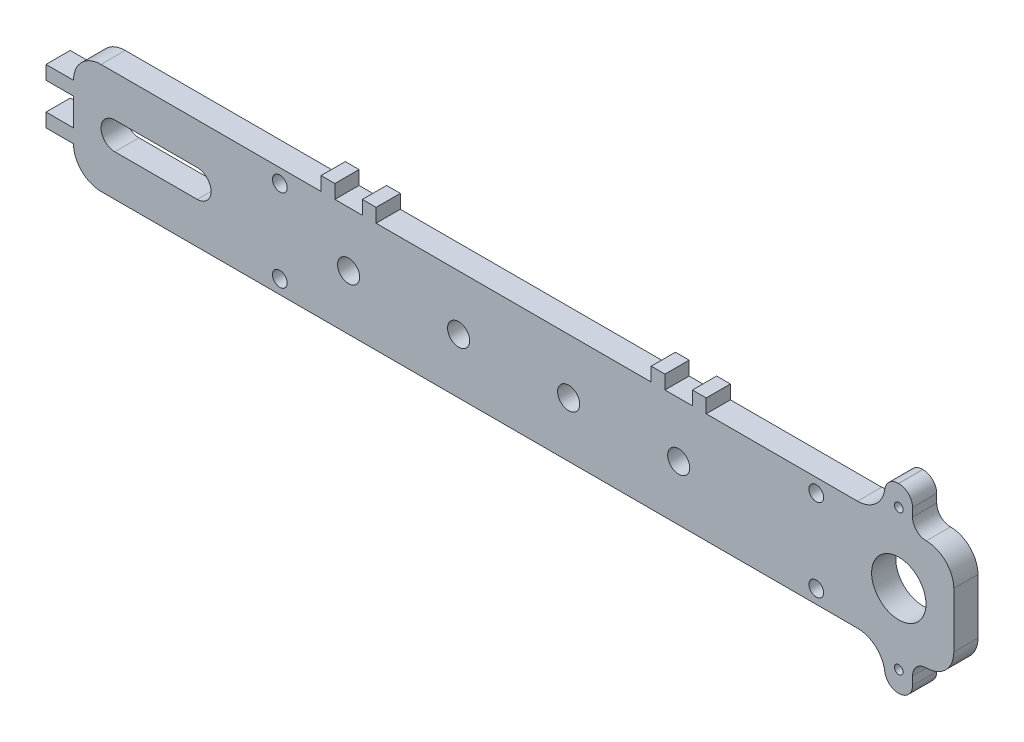
from build123d import *

# Parameters (mm, degrees)
SKETCH2_R           = 1.7
SKETCH2_R_2         = 2.5527
SKETCH2_R_3         = 1
SKETCH2_R_4         = 6.275
BOSS_EXTRUDE1_DEPTH = 5.588
FILLET1_R           = 6.35
FILLET2_R           = 3.175


with BuildPart() as part:
    # Sketch2 → Boss-Extrude1 (new body)
    with BuildSketch(Plane.XY):
        Polygon((-44.45, 12.7), (-101.6, 12.7), (-101.6, 6.35), (-107.95, 6.35), (-107.95, 3.175), (-101.6, 3.175), (-101.6, -3.175), (-107.95, -3.175), (-107.95, -6.35), (-101.6, -6.35), (-101.6, -12.7), (85.725, -12.7), (85.725, -20.9775), (92.075, -20.9775), (92.075, -12.7), (101.6, -12.7), (101.6, 12.7), (92.075, 12.7), (92.075, 20.9775), (85.725, 20.9775), (85.725, 12.7), (44.45, 12.7), (44.45, 15.875), (41.275, 15.875), (41.275, 12.7), (34.925, 12.7), (34.925, 15.875), (31.75, 15.875), (31.75, 12.7), (-31.75, 12.7), (-31.75, 15.875), (-34.925, 15.875), (-34.925, 12.7), (-41.275, 12.7), (-41.275, 15.875), (-44.45, 15.875), align=None)
        with BuildLine():
            ThreePointArc((-92.075, -3.175), (-95.25, 0), (-92.075, 3.175))
            Line((-92.075, 3.175), (-73.025, 3.175))
            ThreePointArc((-73.025, 3.175), (-69.85, 0), (-73.025, -3.175))
            Line((-73.025, -3.175), (-92.075, -3.175))
        make_face(mode=Mode.SUBTRACT)
        with Locations((-53.975, -9.525)):
            Circle(SKETCH2_R, mode=Mode.SUBTRACT)
        with Locations((-38.1, 0)):
            Circle(SKETCH2_R_2, mode=Mode.SUBTRACT)
        with Locations((-12.7, 0)):
            Circle(SKETCH2_R_2, mode=Mode.SUBTRACT)
        with Locations((88.9, -16.215)):
            Circle(SKETCH2_R_3, mode=Mode.SUBTRACT)
        with Locations((12.7, 0)):
            Circle(SKETCH2_R_2, mode=Mode.SUBTRACT)
        with Locations((38.1, 0)):
            Circle(SKETCH2_R_2, mode=Mode.SUBTRACT)
        with Locations((69.85, -9.525)):
            Circle(SKETCH2_R, mode=Mode.SUBTRACT)
        with Locations((88.9, 0)):
            Circle(SKETCH2_R_4, mode=Mode.SUBTRACT)
        with Locations((-53.975, 9.525)):
            Circle(SKETCH2_R, mode=Mode.SUBTRACT)
        with Locations((69.85, 9.525)):
            Circle(SKETCH2_R, mode=Mode.SUBTRACT)
        with Locations((88.9, 16.215)):
            Circle(SKETCH2_R_3, mode=Mode.SUBTRACT)
    extrude(amount=BOSS_EXTRUDE1_DEPTH)

    # Fillet1
    fillet1_edges = [part.edges().sort_by_distance(p)[0] for p in [
        (101.6, -12.7, 2.794),
        (101.6, 12.7, 2.794),
        (-101.6, -12.7, 2.794),
        (-101.6, 12.7, 2.794),
        (85.725, -12.7, 2.794),
        (85.725, 12.7, 2.794),
    ]]
    fillet(fillet1_edges, radius=FILLET1_R - 0.0001)  # a hair under: the kernel refuses the full size

    # Fillet2
    fillet2_edges = [part.edges().sort_by_distance(p)[0] for p in [
        (85.725, -20.9775, 2.794),
        (92.075, -20.9775, 2.794),
        (92.075, -12.7, 2.794),
        (92.075, 12.7, 2.794),
        (92.075, 20.9775, 2.794),
        (85.725, 20.9775, 2.794),
    ]]
    fillet(fillet2_edges, radius=FILLET2_R)


solid = part.part
